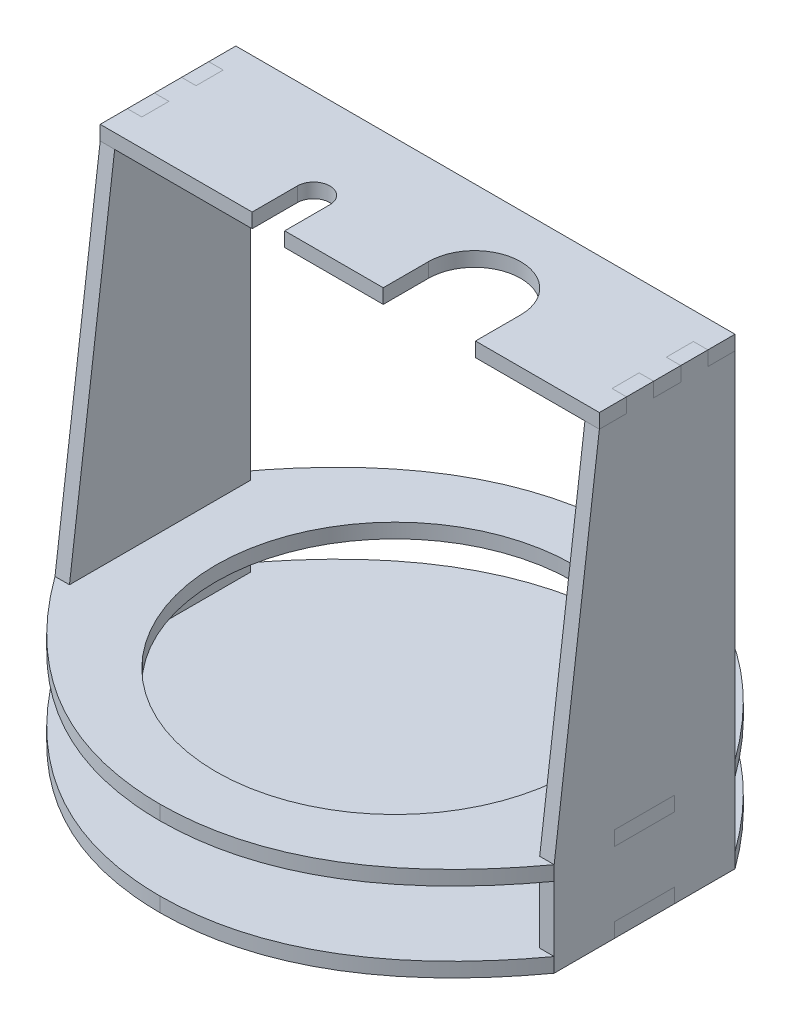
from build123d import *

# Parameters (mm, degrees)
BOSS_EXTRUDE1_DEPTH = 4
SKETCH2_W           = 16.666666666
SKETCH2_H           = 4
BOSS_EXTRUDE2_DEPTH = 4
SKETCH4_R           = 49.5
BOSS_EXTRUDE3_DEPTH = 4
SKETCH5_W           = 16.666666666
SKETCH5_H           = 4
BOSS_EXTRUDE4_DEPTH = 4
BOSS_EXTRUDE5_DEPTH = 4
INDENT3_OUTLINE_W   = 4
INDENT3_OUTLINE_H   = 16.666666666
INDENT3_DEPTH       = 4
INDENT3_START       = 22
INDENT3_2_OUTLINE_W = 4
INDENT3_2_OUTLINE_H = 16.666666666
INDENT3_2_DEPTH     = 4
LPATTERN1_COUNT     = 2
LPATTERN1_PITCH     = 134
INDENT5_OUTLINE_W   = 4
INDENT5_OUTLINE_H   = 16.666666666
INDENT5_DEPTH       = 4
INDENT5_START       = 22
INDENT5_2_OUTLINE_W = 4
INDENT5_2_OUTLINE_H = 16.666666666
INDENT5_2_DEPTH     = 4
SKETCH8_W           = 4
SKETCH8_H           = 7.5
BOSS_EXTRUDE6_DEPTH = 4
LPATTERN3_COUNT     = 2
LPATTERN3_PITCH     = 134
BOSS_EXTRUDE7_DEPTH = 4
INDENT6_START       = -17.5
INDENT6_OUTLINE_W   = 4
INDENT6_OUTLINE_H   = 4
INDENT6_DEPTH       = 7.5
INDENT6_START_2     = -2.5
INDENT6_2_OUTLINE_W = 4
INDENT6_2_OUTLINE_H = 4
INDENT6_2_DEPTH     = 7.5


# Read off the part's stored shape, not the designer's step: Indent3, Indent5, Indent6
with BuildPart() as part:
    # Sketch1 → Boss-Extrude1 (new body)
    with BuildSketch(Plane(origin=(0, 0, 0), x_dir=(1, 0, 0), z_dir=(0, 1, 0))):
        with BuildLine():
            Line((-65, 25), (-65, -25))
            Line((-65, -25), (-69, -25))
            add(Edge.make_bspline(
                [(-69, -25), (-39.849959526, -64.895836828), (-2.6224e-05, -65)],
                knots=[0, 0, 0, 1, 1, 1], degree=2))
            add(Edge.make_bspline(
                [(-2.6224e-05, -65), (39.849922378, -64.895858771), (69, -25)],
                knots=[0, 0, 0, 1, 1, 1], degree=2))
            Line((69, -25), (65, -25))
            Line((65, -25), (65, 25))
            Line((65, 25), (69, 25))
            add(Edge.make_bspline(
                [(69, 25), (39.849915495, 64.895868161), (-4.5036e-05, 65)],
                knots=[0, 0, 0, 1, 1, 1], degree=2))
            add(Edge.make_bspline(
                [(-4.5036e-05, 65), (-39.849966409, 64.895827437), (-69, 25)],
                knots=[0, 0, 0, 1, 1, 1], degree=2))
            Line((-69, 25), (-65, 25))
        make_face()
    extrude(amount=BOSS_EXTRUDE1_DEPTH)

    # Sketch2 → Boss-Extrude2 (add)
    with BuildSketch(Plane(origin=(65, 0, 0), x_dir=(0, 0, -1), z_dir=(1, 0, 0))):
        with Locations((0, 2)):
            Rectangle(SKETCH2_W, SKETCH2_H)
    boss_extrude2 = extrude(amount=BOSS_EXTRUDE2_DEPTH)

    # Mirror1: Boss-Extrude2 across plane
    add(boss_extrude2.mirror(Plane(origin=(0, 0, 0), x_dir=(0, 0, 1), z_dir=(1, 0, 0))))


with BuildPart() as body_2:
    # Sketch4 → Boss-Extrude3 (new body)
    with BuildSketch(Plane(origin=(0, 22, 0), x_dir=(1, 0, 0), z_dir=(0, 1, 0))):
        with BuildLine():
            add(Edge.make_bspline(
                [(-69, -25), (-39.849959526, -64.895836827), (-2.6225e-05, -65)],
                knots=[0, 0, 0, 1, 1, 1], degree=2))
            add(Edge.make_bspline(
                [(-2.6225e-05, -65), (39.849922378, -64.895858771), (69, -25)],
                knots=[0, 0, 0, 1, 1, 1], degree=2))
            Line((69, -25), (65, -25))
            Line((65, -25), (65, 25))
            Line((65, 25), (69, 25))
            add(Edge.make_bspline(
                [(69, 25), (39.849915496, 64.895868161), (-4.5035e-05, 65)],
                knots=[0, 0, 0, 1, 1, 1], degree=2))
            add(Edge.make_bspline(
                [(-4.5035e-05, 65), (-39.849966364, 64.895827438), (-68.999999935, 25.000000088)],
                knots=[0, 0, 0, 1, 1, 1], degree=2))
            Line((-68.999999935, 25.000000088), (-65, 25))
            Line((-65, 25), (-65, -25))
            Line((-65, -25), (-69, -25))
        make_face()
        with Locations(Location((0, 0, 0), (0, 0, 270))):
            Circle(SKETCH4_R, mode=Mode.SUBTRACT)
    extrude(amount=BOSS_EXTRUDE3_DEPTH)

    # Sketch5 → Boss-Extrude4 (add)
    with BuildSketch(Plane(origin=(65, 0, 0), x_dir=(0, 0, -1), z_dir=(1, 0, 0))):
        with Locations((0, 24)):
            Rectangle(SKETCH5_W, SKETCH5_H)
    boss_extrude4 = extrude(amount=BOSS_EXTRUDE4_DEPTH)

    # Mirror2: Boss-Extrude4 across plane
    add(boss_extrude4.mirror(Plane(origin=(0, 0, 0), x_dir=(0, 0, 1), z_dir=(1, 0, 0))))


with BuildPart() as body_3:
    # Sketch6 → Boss-Extrude5 (new body)
    with BuildSketch(Plane(origin=(65, 0, 0), x_dir=(0, 0, -1), z_dir=(1, 0, 0))):
        Polygon((25, 26), (25, 124), (-12.5, 124), (-25, 26), (-25, 0), (25, 0), align=None)
    boss_extrude5 = extrude(amount=BOSS_EXTRUDE5_DEPTH)

    # Indent3 outline → Indent3 (cut)
    with BuildSketch(Plane(origin=(0, 0, 0), x_dir=(1, 0, 0), z_dir=(0, 1, 0))):
        with Locations((67, 0)):
            Rectangle(INDENT3_OUTLINE_W, INDENT3_OUTLINE_H)
    extrude(amount=INDENT3_DEPTH, mode=Mode.SUBTRACT)

    # Indent3 2 outline → Indent3 2 (cut)
    with BuildSketch(Plane(origin=(0, 0, 0), x_dir=(1, 0, 0), z_dir=(0, 1, 0)).offset(INDENT3_START)):
        with Locations((67, 0)):
            Rectangle(INDENT3_2_OUTLINE_W, INDENT3_2_OUTLINE_H)
    extrude(amount=INDENT3_2_DEPTH, mode=Mode.SUBTRACT)

    # Sketch8 → Boss-Extrude6 (add)
    with BuildSketch(Plane(origin=(0, 124, 0), x_dir=(1, 0, 0), z_dir=(0, 1, 0))):
        with Locations((67, 13.75)):
            Rectangle(SKETCH8_W, SKETCH8_H)
        with Locations((67, -1.25)):
            Rectangle(SKETCH8_W, SKETCH8_H)
    boss_extrude6 = extrude(amount=BOSS_EXTRUDE6_DEPTH)


with BuildPart() as lpattern1_1:
    # LPattern1: Boss-Extrude5 ×2
    with Locations(*[(-i * LPATTERN1_PITCH, 0, 0) for i in range(1, LPATTERN1_COUNT)]):
        add(boss_extrude5)

    # Indent5 outline → Indent5 (cut)
    with BuildSketch(Plane(origin=(0, 0, 0), x_dir=(1, 0, 0), z_dir=(0, 1, 0))):
        with Locations((-67, 0)):
            Rectangle(INDENT5_OUTLINE_W, INDENT5_OUTLINE_H)
    extrude(amount=INDENT5_DEPTH, mode=Mode.SUBTRACT)

    # Indent5 2 outline → Indent5 2 (cut)
    with BuildSketch(Plane(origin=(0, 0, 0), x_dir=(1, 0, 0), z_dir=(0, 1, 0)).offset(INDENT5_START)):
        with Locations((-67, 0)):
            Rectangle(INDENT5_2_OUTLINE_W, INDENT5_2_OUTLINE_H)
    extrude(amount=INDENT5_2_DEPTH, mode=Mode.SUBTRACT)

    # LPattern3: Boss-Extrude6 ×2
    with Locations(*[(-i * LPATTERN3_PITCH, 0, 0) for i in range(1, LPATTERN3_COUNT)]):
        add(boss_extrude6)


with BuildPart() as body_5:
    # Sketch9 → Boss-Extrude7 (new body)
    with BuildSketch(Plane(origin=(0, 124, 0), x_dir=(1, 0, 0), z_dir=(0, 1, 0))):
        with BuildLine():
            Line((-69, -12.5), (-27, -12.5))
            Line((-27, -12.5), (-27, 0))
            ThreePointArc((-27, 0), (-22.5, 4.5), (-18, 0))
            Line((-18, 0), (-18, -12.5))
            Line((-18, -12.5), (9.25, -12.5))
            Line((9.25, -12.5), (9.25, 0))
            ThreePointArc((9.25, 0), (22, 12.75), (34.75, 0))
            Line((34.75, 0), (34.75, -12.5))
            Line((34.75, -12.5), (69, -12.5))
            Line((69, -12.5), (69, 25))
            Line((69, 25), (-69, 25))
            Line((-69, 25), (-69, -12.5))
        make_face()
    extrude(amount=BOSS_EXTRUDE7_DEPTH)

    # Indent6 outline → Indent6 (cut)
    with BuildSketch(Plane.XY.offset(INDENT6_START)):
        with Locations((67, 126)):
            Rectangle(INDENT6_OUTLINE_W, INDENT6_OUTLINE_H)
        with Locations((-67, 126)):
            Rectangle(INDENT6_OUTLINE_W, INDENT6_OUTLINE_H)
    extrude(amount=INDENT6_DEPTH, mode=Mode.SUBTRACT)

    # Indent6 2 outline → Indent6 2 (cut)
    with BuildSketch(Plane.XY.offset(INDENT6_START_2)):
        with Locations((67, 126)):
            Rectangle(INDENT6_2_OUTLINE_W, INDENT6_2_OUTLINE_H)
        with Locations((-67, 126)):
            Rectangle(INDENT6_2_OUTLINE_W, INDENT6_2_OUTLINE_H)
    extrude(amount=INDENT6_2_DEPTH, mode=Mode.SUBTRACT)


solid = Compound([part.part, body_2.part, body_3.part, lpattern1_1.part, body_5.part])
